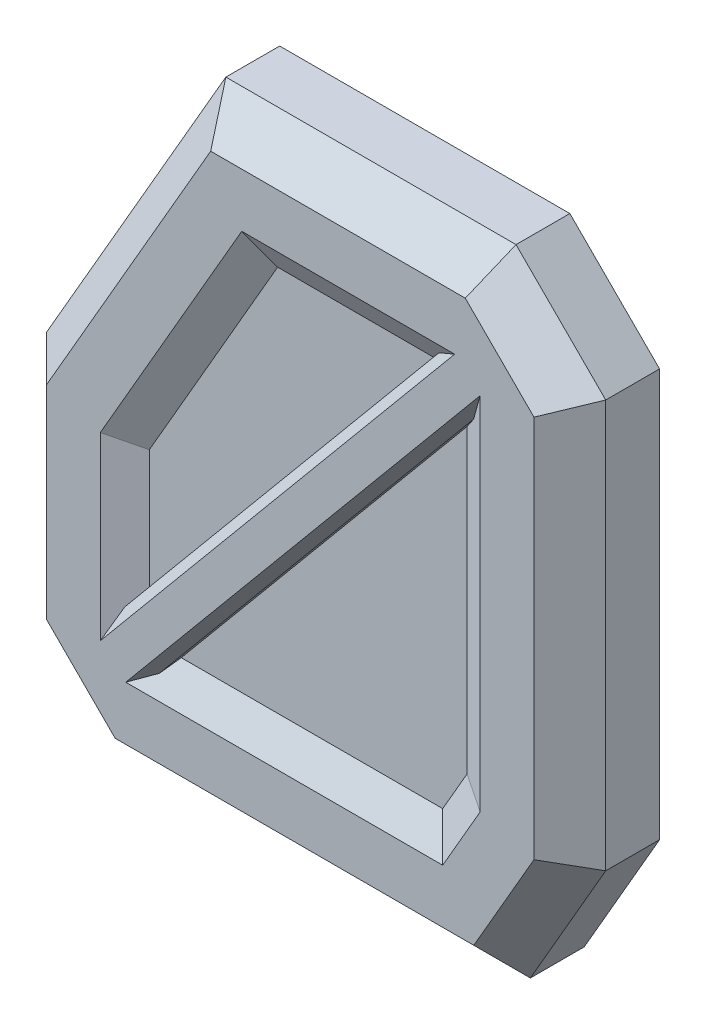
from build123d import *
from OCP.BRepFilletAPI import BRepFilletAPI_MakeChamfer

# Parameters (mm, degrees)
BOSS_EXTRU_1_DEPTH      = 50
CHANFREIN1_SIZE         = 20
ENL_V_MAT_EXTRU_1_DEPTH = 10
CHANFREIN2_SIZE         = 10
CHANFREIN2_SIZE_2       = 17.320508076
CHANFREIN3_SIZE         = 5
ENL_V_MAT_EXTRU_2_DEPTH = 30
ESQUISSE4_W             = 311.726027397
ESQUISSE4_H             = 51.931996983
ENL_V_MAT_EXTRU_3_DEPTH = 681.504586336


# Some blends are built 0.0001 mm under size
with BuildPart() as part:
    # Esquisse1 → Boss.-Extru.1 (new body)
    with BuildSketch(Plane.XY):
        Polygon((0, 0), (219.726027397, 0), (269.726027397, 50), (269.726027397, 176.794919243), (169.726027397, 350), (8, 350), (-42, 300), (-42, 72.746133918), align=None)
    extrude(amount=BOSS_EXTRU_1_DEPTH)

    # Chanfrein1
    chanfrein1_edges = [part.edges().sort_by_distance(p)[0] for p in [
        (244.726027397, 25, 50),
        (269.726027397, 113.397459622, 50),
        (219.726027397, 263.397459622, 50),
        (88.863013699, 350, 50),
        (-17, 325, 50),
        (-42, 186.373066959, 50),
        (-21, 36.373066959, 50),
        (109.863013699, 0, 50),
    ]]
    chamfer(chanfrein1_edges, length=CHANFREIN1_SIZE)

    # Esquisse2 → Enlèv. mat.-Extru.1 (cut)
    with BuildSketch(Plane.XY.offset(50)):
        Polygon((28.710678119, 300), (219.726027397, 70.710678119), (219.726027397, 163.397459622), (140.858513938, 300), align=None)
        Polygon((199.015349279, 50), (8, 279.289321881), (8, 86.143593539), (28.867513459, 50), align=None)
    extrude(amount=-ENL_V_MAT_EXTRU_1_DEPTH, mode=Mode.SUBTRACT)

    # Chanfrein2
    chanfrein2_edges_1 = [part.edges().sort_by_distance(p)[0] for p in [
        (219.726027397, 117.05406887, 40),
    ]]
    chanfrein2_side_1 = [part.faces().sort_by_distance(p)[0] for p in [
        (219.726027397, 117.05406887, 40.2),
    ]]
    chanfrein2_edges_2 = [part.edges().sort_by_distance(p)[0] for p in [
        (180.292270668, 231.698729811, 40),
    ]]
    chanfrein2_side_2 = [part.faces().sort_by_distance(p)[0] for p in [
        (180.292270668, 231.698729811, 40.2),
    ]]
    chanfrein2_edges_3 = [part.edges().sort_by_distance(p)[0] for p in [
        (84.784596028, 300, 40),
    ]]
    chanfrein2_side_3 = [part.faces().sort_by_distance(p)[0] for p in [
        (84.784596028, 300, 40.2),
    ]]
    chanfrein2_edges_4 = [part.edges().sort_by_distance(p)[0] for p in [
        (113.941431369, 50, 40),
    ]]
    chanfrein2_side_4 = [part.faces().sort_by_distance(p)[0] for p in [
        (113.941431369, 50, 40.2),
    ]]
    chanfrein2_edges_5 = [part.edges().sort_by_distance(p)[0] for p in [
        (18.43375673, 68.07179677, 40),
    ]]
    chanfrein2_side_5 = [part.faces().sort_by_distance(p)[0] for p in [
        (18.43375673, 68.07179677, 40.2),
    ]]
    chanfrein2_edges_6 = [part.edges().sort_by_distance(p)[0] for p in [
        (8, 182.71645771, 40),
    ]]
    chanfrein2_side_6 = [part.faces().sort_by_distance(p)[0] for p in [
        (8, 182.71645771, 40.2),
    ]]
    chanfrein2 = BRepFilletAPI_MakeChamfer(part.part.solid().wrapped)
    for e in chanfrein2_edges_1:
        chanfrein2.Add(CHANFREIN2_SIZE - 0.0001, CHANFREIN2_SIZE_2 - 0.0001, e.wrapped, chanfrein2_side_1[0].wrapped)
    for e in chanfrein2_edges_2:
        chanfrein2.Add(CHANFREIN2_SIZE - 0.0001, CHANFREIN2_SIZE_2 - 0.0001, e.wrapped, chanfrein2_side_2[0].wrapped)
    for e in chanfrein2_edges_3:
        chanfrein2.Add(CHANFREIN2_SIZE - 0.0001, CHANFREIN2_SIZE_2 - 0.0001, e.wrapped, chanfrein2_side_3[0].wrapped)
    for e in chanfrein2_edges_4:
        chanfrein2.Add(CHANFREIN2_SIZE - 0.0001, CHANFREIN2_SIZE_2 - 0.0001, e.wrapped, chanfrein2_side_4[0].wrapped)
    for e in chanfrein2_edges_5:
        chanfrein2.Add(CHANFREIN2_SIZE - 0.0001, CHANFREIN2_SIZE_2 - 0.0001, e.wrapped, chanfrein2_side_5[0].wrapped)
    for e in chanfrein2_edges_6:
        chanfrein2.Add(CHANFREIN2_SIZE - 0.0001, CHANFREIN2_SIZE_2 - 0.0001, e.wrapped, chanfrein2_side_6[0].wrapped)
    add(Compound.cast(chanfrein2.Shape()), mode=Mode.REPLACE)  # a hair under: the kernel refuses the full size

    # Chanfrein3
    # the kernel refuses this chamfer: 5 mm, written as the material it takes off along each edge
    with BuildSketch(Plane(origin=(20.480424013, 309.879359904, 50), x_dir=(-0.768028153682994, -0.6398255480361086, 0.02749587661058626), z_dir=(0.6400675467511631, -0.7683186419682577, 0))) as chanfrein3_piece_1_section:
        Polygon((CHANFREIN3_SIZE * 0.999621916911, CHANFREIN3_SIZE * 0.0274958766106), (-CHANFREIN3_SIZE * 0.0274958766106, CHANFREIN3_SIZE * 0.999621916911), (0, 0), align=None)
    chanfrein3_piece_1 = extrude(amount=324.14681629, mode=Mode.PRIVATE)
    chanfrein3_piece_1 = split(chanfrein3_piece_1, bisect_by=Plane(origin=(122.894695162, 300, 48.383637618), z_dir=(0, -1, 0)), keep=Keep.TOP, mode=Mode.PRIVATE)
    chanfrein3_piece_1 = split(chanfrein3_piece_1, bisect_by=Plane(origin=(122.894695162, 212.546373523, -0.491261384), z_dir=(0, -0.4999984150451088, 0.8660263188566379)), keep=Keep.TOP, mode=Mode.PRIVATE)
    chanfrein3_piece_1 = split(chanfrein3_piece_1, bisect_by=Plane(origin=(219.726027397, 184.328556692, 48.383637618), z_dir=(-1, 0, 0)), keep=Keep.TOP, mode=Mode.PRIVATE)
    chanfrein3_piece_1 = split(chanfrein3_piece_1, bisect_by=Plane(origin=(146.402514085, 184.328556692, 7.666728775), z_dir=(-0.49999841504510817, 0, 0.8660263188566384)), keep=Keep.TOP, mode=Mode.PRIVATE)
    add(chanfrein3_piece_1, mode=Mode.SUBTRACT)
    with BuildSketch(Plane(origin=(207.245603384, 40.120640096, 50), x_dir=(-0.02112559457717319, -0.017599218287911274, -0.9996219169112968), z_dir=(-0.6400675467511632, 0.7683186419682577, 0))) as chanfrein3_piece_2_section:
        Polygon((CHANFREIN3_SIZE * 0.999621916911, -CHANFREIN3_SIZE * 0.0274958766106), (-CHANFREIN3_SIZE * 0.0274958766106, -CHANFREIN3_SIZE * 0.999621916911), (0, 0), align=None)
    chanfrein3_piece_2 = extrude(amount=324.14681629, mode=Mode.PRIVATE)
    chanfrein3_piece_2 = split(chanfrein3_piece_2, bisect_by=Plane(origin=(104.831332235, 50, 48.383637618), z_dir=(0, 1, 0)), keep=Keep.TOP, mode=Mode.PRIVATE)
    chanfrein3_piece_2 = split(chanfrein3_piece_2, bisect_by=Plane(origin=(104.831332235, 137.453626477, -0.491261384), z_dir=(0, 0.4999984150451082, 0.8660263188566383)), keep=Keep.TOP, mode=Mode.PRIVATE)
    chanfrein3_piece_2 = split(chanfrein3_piece_2, bisect_by=Plane(origin=(8, 165.671443308, 48.383637618), z_dir=(1, 0, 0)), keep=Keep.TOP, mode=Mode.PRIVATE)
    chanfrein3_piece_2 = split(chanfrein3_piece_2, bisect_by=Plane(origin=(81.323513312, 165.671443308, 7.666728775), z_dir=(0.49999841504510834, 0, 0.8660263188566383)), keep=Keep.TOP, mode=Mode.PRIVATE)
    add(chanfrein3_piece_2, mode=Mode.SUBTRACT)

    # Esquisse3 → Enlèv. mat.-Extru.2 (cut)
    with BuildSketch(Plane(origin=(0, 0, 0), x_dir=(-1, 0, 0), z_dir=(0, 0, -1))):
        Polygon((-5.773502692, 10), (32, 75.425625842), (32, 295.857864376), (-12.142135624, 340), (-163.952524705, 340), (-259.726027397, 174.115427319), (-259.726027397, 54.142135624), (-215.583891774, 10), align=None)
    extrude(amount=-ENL_V_MAT_EXTRU_2_DEPTH, mode=Mode.SUBTRACT)

    # Symétrie1: part across plane


with BuildPart() as part_1:
    add(part.part)
    add(part.part.mirror(Plane(origin=(269.726027397, 50, 50), x_dir=(0, 0, 1), z_dir=(-1, 0, 0))))

    # Esquisse4 → Enlèv. mat.-Extru.3 (cut, through all)
    with BuildSketch(Plane(origin=(0, 350, 0), x_dir=(1, 0, 0), z_dir=(0, 1, 0))):
        with Locations((113.863013698, -25.965998492)):
            Rectangle(ESQUISSE4_W, ESQUISSE4_H)
    extrude(amount=-ENL_V_MAT_EXTRU_3_DEPTH, mode=Mode.SUBTRACT)


solid = part_1.part
